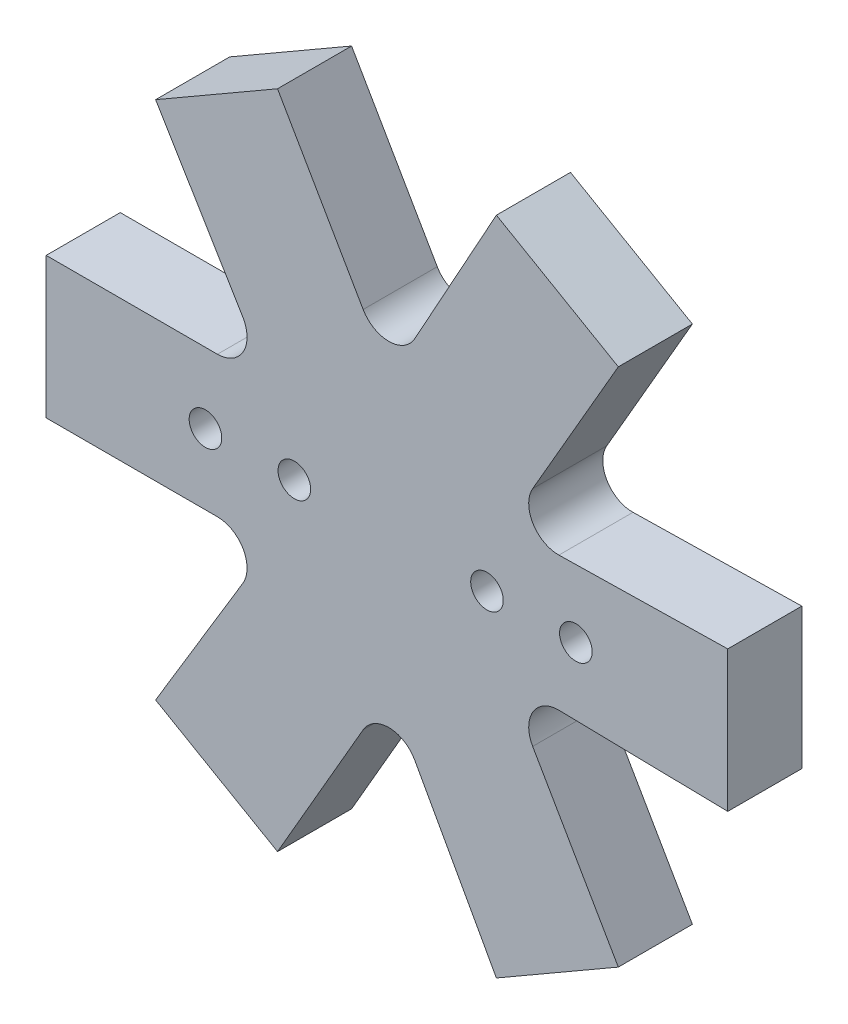
from build123d import *

# Parameters (mm, degrees)
BOSS_EXTRUDE2_DEPTH = 5
CUT_EXTRUDE1_DEPTH  = 2
SKETCH3_R           = 1.1
CUT_EXTRUDE2_DEPTH  = 33.350678515


with BuildPart() as part:
    # Sketch1 → Boss-Extrude2 (new body)
    with BuildSketch(Plane.XY):
        with BuildLine():
            Line((-23.25, 4.75), (-23.25, -4.75))
            Line((-23.25, -4.75), (-11.691342951, -4.75))
            ThreePointArc((-11.691342951, -4.75), (-9.949887623, -5.766468943), (-9.978567551, -7.78266666))
            Line((-9.978567551, -7.78266666), (-15.863620668, -17.543584287))
            Line((-15.863620668, -17.543584287), (-7.636379332, -22.293584287))
            Line((-7.636379332, -22.293584287), (-1.857050808, -12.283493649))
            ThreePointArc((-1.857050808, -12.283493649), (-0.106035217, -11.283583567), (1.625703261, -12.316519972))
            Line((1.625703261, -12.316519972), (7.136379332, -22.293584287))
            Line((7.136379332, -22.293584287), (15.363620668, -17.543584287))
            Line((15.363620668, -17.543584287), (9.584292144, -7.533493649))
            ThreePointArc((9.584292144, -7.533493649), (9.593852406, -5.517114624), (11.354270812, -4.533853312))
            Line((11.354270812, -4.533853312), (22.75, -4.75))
            Line((22.75, -4.75), (22.75, 4.75))
            Line((22.75, 4.75), (11.354270812, 4.533853312))
            ThreePointArc((11.354270812, 4.533853312), (9.593852406, 5.517114624), (9.584292144, 7.533493649))
            Line((9.584292144, 7.533493649), (15.363620668, 17.543584287))
            Line((15.363620668, 17.543584287), (7.136379332, 22.293584287))
            Line((7.136379332, 22.293584287), (1.625703261, 12.316519972))
            ThreePointArc((1.625703261, 12.316519972), (-0.106035217, 11.283583567), (-1.857050808, 12.283493649))
            Line((-1.857050808, 12.283493649), (-7.636379332, 22.293584287))
            Line((-7.636379332, 22.293584287), (-15.863620668, 17.543584287))
            Line((-15.863620668, 17.543584287), (-9.978567551, 7.78266666))
            ThreePointArc((-9.978567551, 7.78266666), (-9.949887623, 5.766468943), (-11.691342951, 4.75))
            Line((-11.691342951, 4.75), (-23.25, 4.75))
        make_face()
    extrude(amount=BOSS_EXTRUDE2_DEPTH)

    # Sketch2 → Cut-Extrude1 (cut)
    with BuildSketch(Plane(origin=(0, 0, 0), x_dir=(-1, 0, 0), z_dir=(0, 0, -1))):
        with BuildLine():
            Line((0.780612245, 4.177696078), (12.617346939, 1.965974625))
            ThreePointArc((12.617346939, 1.965974625), (14.25, 0), (12.617346939, -1.965974625))
            Line((12.617346939, -1.965974625), (0.780612245, -4.177696078))
            ThreePointArc((0.780612245, -4.177696078), (0, -4.25), (-0.780612245, -4.177696078))
            Line((-0.780612245, -4.177696078), (-12.617346939, -1.965974625))
            ThreePointArc((-12.617346939, -1.965974625), (-14.25, 0), (-12.617346939, 1.965974625))
            Line((-12.617346939, 1.965974625), (-0.780612245, 4.177696078))
            ThreePointArc((-0.780612245, 4.177696078), (0, 4.25), (0.780612245, 4.177696078))
        make_face()
    extrude(amount=-CUT_EXTRUDE1_DEPTH, mode=Mode.SUBTRACT)

    # Sketch3 → Cut-Extrude2 (cut, through all)
    with BuildSketch(Plane(origin=(0, 0, 2), x_dir=(-1, 0, 0), z_dir=(0, 0, -1))):
        with Locations((-6.5, 0)):
            Circle(SKETCH3_R)
        with Locations((-12.5, 0)):
            Circle(SKETCH3_R)
        with Locations((6.5, 0)):
            Circle(SKETCH3_R)
        with Locations((12.5, 0)):
            Circle(SKETCH3_R)
    extrude(amount=-CUT_EXTRUDE2_DEPTH, mode=Mode.SUBTRACT)


solid = part.part
